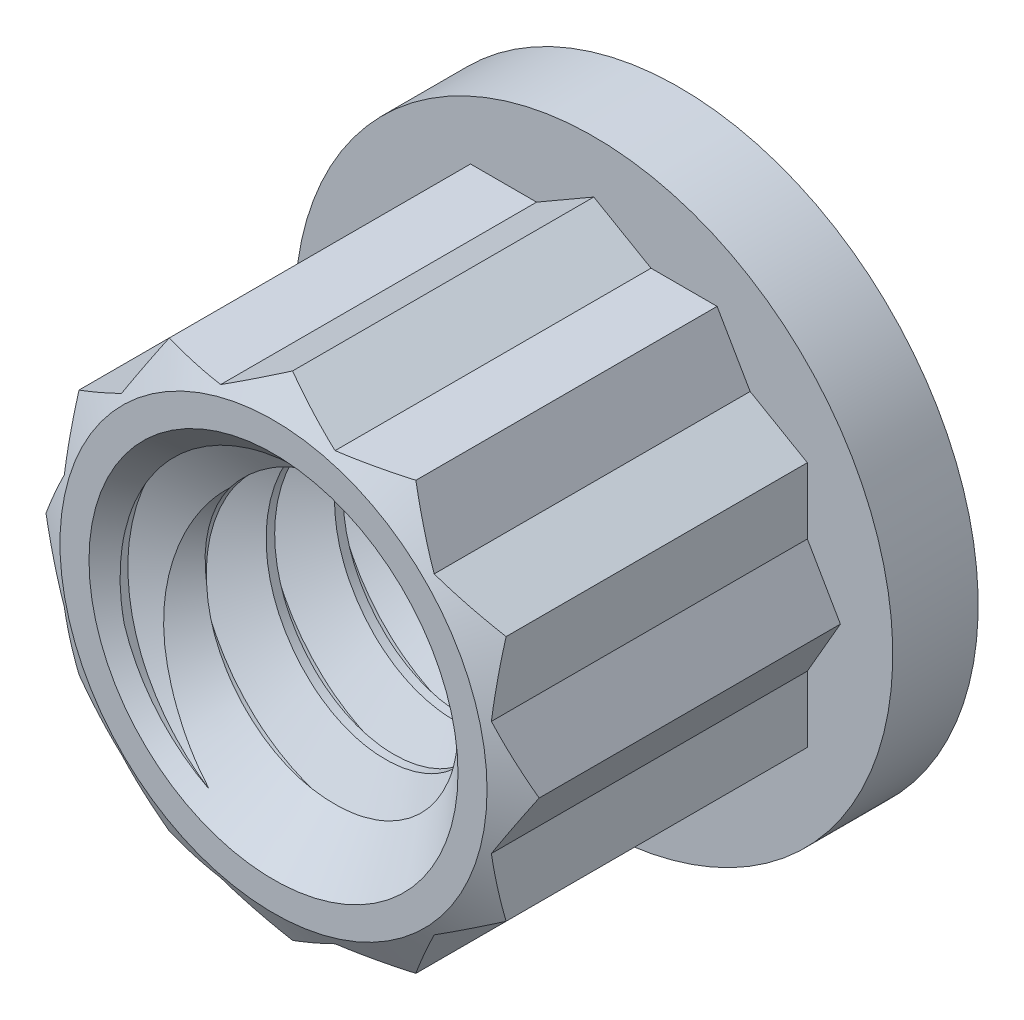
from build123d import *

# Parameters (mm, degrees)
EXTRUDE1_DEPTH     = 7.540625
EXTRUDE4_DEPTH     = 7.540625
SKETCH13_R         = 5.55625
EXTRUDE3_DEPTH     = 1.5875
SKETCH2_OUTSIDE_W  = 57.788
SKETCH2_OUTSIDE_H  = 57.788
SKETCH2_OUTSIDE_R  = 3.96875
CUT_EXTRUDE1_DEPTH = 11.890585545
CUT_EXTRUDE1_DRAFT = -60
SKETCH4_R          = 3.175
CUT_EXTRUDE3_DEPTH = 11.890585545
SKETCH12_R         = 3.175
SKETCH12_R_2       = 2.350110803
EXTRUDE2_DEPTH     = 7.540625
CUT_SWEEP1_PITCH   = 1.27


with BuildPart() as part:
    # Sketch1 → Extrude1 (new body)
    with BuildSketch(Plane.XY):
        Polygon((0, 4.582717762), (-3.96875, 2.291358881), (-3.96875, -2.291358881), (0, -4.582717762), (3.96875, -2.291358881), (3.96875, 2.291358881), align=None)
    extrude(amount=-EXTRUDE1_DEPTH)

    # Sketch14 → Extrude4 (add)
    with BuildSketch(Plane.XY):
        Polygon((-2.291358881, 3.96875), (-4.582717762, 0), (-2.291358881, -3.96875), (2.291358881, -3.96875), (4.582717762, 0), (2.291358881, 3.96875), align=None)
    extrude(amount=-EXTRUDE4_DEPTH)

    # Sketch13 → Extrude3 (add)
    with BuildSketch(Plane(origin=(0, 0, -7.540625), x_dir=(-1, 0, 0), z_dir=(0, 0, -1))):
        Circle(SKETCH13_R)
    extrude(amount=-EXTRUDE3_DEPTH)


with BuildPart() as cut_extrude1_tool:
    # Sketch2 outside → Cut-Extrude1 (with draft: the straight prism first)
    with BuildSketch(Plane.XY):
        Rectangle(SKETCH2_OUTSIDE_W, SKETCH2_OUTSIDE_H)
        Circle(SKETCH2_OUTSIDE_R, mode=Mode.SUBTRACT)
    extrude(amount=-CUT_EXTRUDE1_DEPTH)
    # Cut-Extrude1: the draft: its side faces are tilted about the plane it starts from
    cut_extrude1_sides = [cut_extrude1_tool.faces().sort_by_distance(p)[0] for p in [
        (0, -28.894, -5.945292773),
        (28.894, 0, -5.945292773),
        (0, 28.894, -5.945292773),
        (-28.894, 0, -5.945292773),
        (-3.96875, 0, -5.945292773),
    ]]
    draft(cut_extrude1_sides, Plane.XY, CUT_EXTRUDE1_DRAFT)


with BuildPart() as part_1:
    add(part.part)

    # Cut-Extrude1: cut by cut_extrude1_tool
    add(cut_extrude1_tool.part, mode=Mode.SUBTRACT)

    # Sketch4 → Cut-Extrude3 (cut, through all)
    with BuildSketch(Plane.XY):
        Circle(SKETCH4_R)
    extrude(amount=-CUT_EXTRUDE3_DEPTH, mode=Mode.SUBTRACT)

    # Sketch12 → Extrude2 (add)
    with BuildSketch(Plane.XY):
        Circle(SKETCH12_R)
        Circle(SKETCH12_R_2, mode=Mode.SUBTRACT)
    extrude(amount=-EXTRUDE2_DEPTH)

    # Cut-Sweep1: the profile of Sketch9 profile screwed along a right-hand helix of 6.9375 turns, 6 arcs to a turn; built about Z, then put on its axis
    cut_sweep1_z = Axis((0, 0, 0), (0, 0, 1))
    cut_sweep1_corners = [(3.175, 0, -0.635), (3.175, 0, -0.47625), (2.349810803, 0, 0.000173205), (2.349810803, 0, -1.111423205)]
    with BuildLine(mode=Mode.PRIVATE) as cut_sweep1_profile:
        Line(cut_sweep1_corners[0], cut_sweep1_corners[1])
        Line(cut_sweep1_corners[1], cut_sweep1_corners[2])
        Line(cut_sweep1_corners[2], cut_sweep1_corners[3])
        Line(cut_sweep1_corners[3], cut_sweep1_corners[0])
    cut_sweep1_cap = Face(cut_sweep1_profile.wire())
    cut_sweep1_turn_angles = [0, 30, 60, 90, 120, 150, 180, 210, 240, 270, 300, 330, 360]
    cut_sweep1_turn_weights = [1, 0.8660254037844387, 1, 0.8660254037844387, 1, 0.8660254037844387, 1, 0.8660254037844387, 1, 0.8660254037844387, 1, 0.8660254037844387, 1]
    cut_sweep1_turn_rails = [Edge.make_bspline([Vector(p[0], p[1], 0).rotate(cut_sweep1_z, cut_sweep1_turn_angles[k]) / cut_sweep1_turn_weights[k] + Vector(0, 0, p[2] + CUT_SWEEP1_PITCH * cut_sweep1_turn_angles[k] / 360) for k in range(13)], [0, 0, 0, 1, 1, 2, 2, 3, 3, 4, 4, 5, 5, 6, 6, 6], 2, cut_sweep1_turn_weights) for p in cut_sweep1_corners]
    cut_sweep1_turn_sides = [Face.make_surface_from_curves(cut_sweep1_turn_rails[p[0]], cut_sweep1_turn_rails[p[1]]) for p in [(0, 1), (1, 2), (2, 3), (3, 0)]]
    cut_sweep1_last_angles = [2160, 2190, 2220, 2250, 2280, 2310, 2340, 2370, 2400, 2430, 2460, 2478.75, 2497.5]
    cut_sweep1_last_weights = [1, 0.8660254037844387, 1, 0.8660254037844387, 1, 0.8660254037844387, 1, 0.8660254037844387, 1, 0.8660254037844387, 1, 0.9469301294950992, 1]
    cut_sweep1_last_rails = [Edge.make_bspline([Vector(p[0], p[1], 0).rotate(cut_sweep1_z, cut_sweep1_last_angles[k]) / cut_sweep1_last_weights[k] + Vector(0, 0, p[2] + CUT_SWEEP1_PITCH * cut_sweep1_last_angles[k] / 360) for k in range(13)], [0, 0, 0, 1, 1, 2, 2, 3, 3, 4, 4, 5, 5, 6, 6, 6], 2, cut_sweep1_last_weights) for p in cut_sweep1_corners]
    cut_sweep1_last_sides = [Face.make_surface_from_curves(cut_sweep1_last_rails[p[0]], cut_sweep1_last_rails[p[1]]) for p in [(0, 1), (1, 2), (2, 3), (3, 0)]]
    cut_sweep1 = Plane(origin=(0, 0, 0), x_dir=(0, 1, 0), z_dir=(0, 0, -1)) * Solid(Shell([*[p.moved(Location((0, 0, CUT_SWEEP1_PITCH * i))) for i in range(6) for p in cut_sweep1_turn_sides], *cut_sweep1_last_sides, cut_sweep1_cap, cut_sweep1_cap.rotate(cut_sweep1_z, 2497.5).moved(Location((0, 0, CUT_SWEEP1_PITCH * 2497.5 / 360)))]))
    add(cut_sweep1, mode=Mode.SUBTRACT)

    # Cut-Extrude6 cone 1 section (through the dimple's axis) → Cut-Extrude6 (revolve, cut)
    with BuildSketch(Plane(origin=(0, 0, 0), x_dir=(0, -1, 0), z_dir=(1, 0, 0))):
        Polygon((0, 0), (3.429, 0), (0, 3.429), align=None)
    revolve(axis=Axis((0, 0, 0), (0, 0, -1)), mode=Mode.SUBTRACT)

    # Cut-Extrude7 cone 1 section (through the dimple's axis) → Cut-Extrude7 (revolve, cut)
    with BuildSketch(Plane(origin=(0, 0, -7.540625), x_dir=(0, 1, 0), z_dir=(1, 0, 0))):
        Polygon((0, 0), (3.429, 0), (0, 3.429), align=None)
    revolve(axis=Axis((0, 0, -7.540625), (0, 0, 1)), mode=Mode.SUBTRACT)


solid = part_1.part
